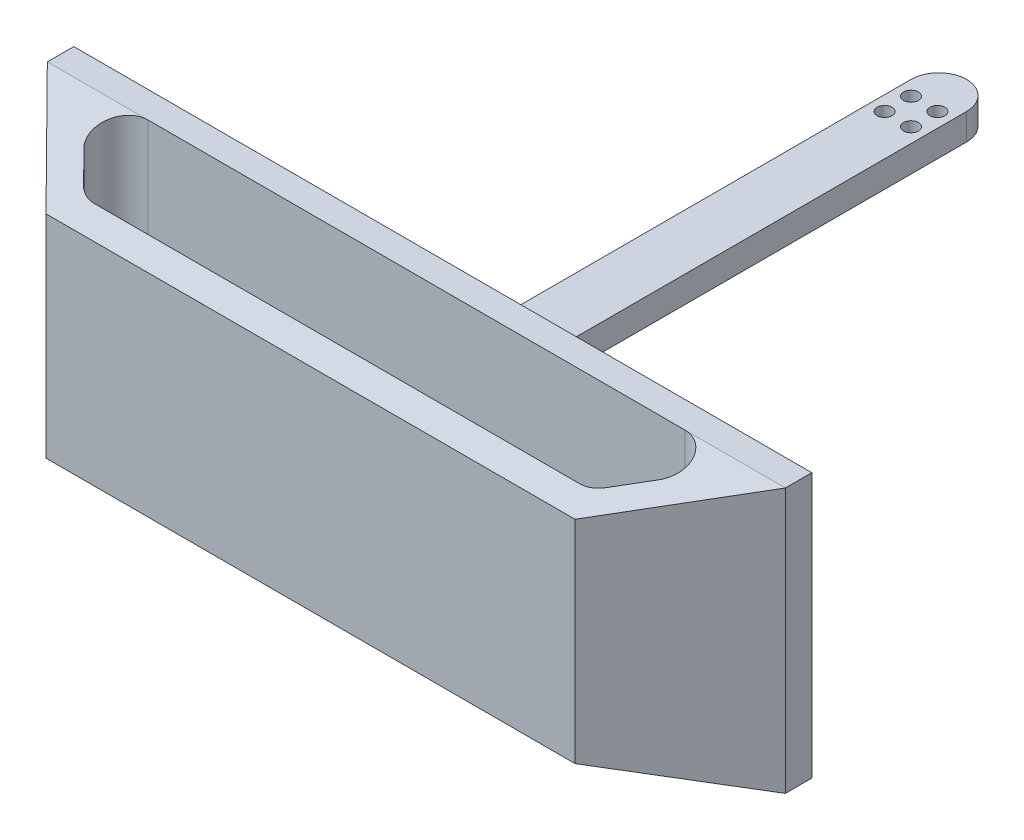
from build123d import *

# Parameters (mm, degrees)
SKETCH1_R               = 1.4
BOSS_EXTRUDE1_DEPTH     = 5
SKETCH3_W               = 139.5
SKETCH3_H               = 50
SKETCH3_R               = 1.4
BOSS_EXTRUDE3_DEPTH     = 5
CUT_EXTRUDE1_DEPTH      = 136.544503915
CUT_EXTRUDE1_DEPTH_BACK = 136.544503915
FILLET1_START           = -25
FILLET1_DEPTH           = 50
FILLET1_START_2         = -21.62169291
FILLET1_2_DEPTH         = 43.24338582
FILLET1_START_3         = -69.75
FILLET1_3_DEPTH         = 139.5


with BuildPart() as part:
    # Sketch1 → Boss-Extrude1 (new body)
    with BuildSketch(Plane(origin=(0, 0, 0), x_dir=(1, 0, 0), z_dir=(0, 1, 0))):
        with BuildLine():
            Line((-5.25, 5.25), (-5.25, -88.5))
            Line((-5.25, -88.5), (5.25, -88.5))
            Line((5.25, -88.5), (5.25, 5.25))
            ThreePointArc((5.25, 5.25), (0, 10.5), (-5.25, 5.25))
        make_face()
        with Locations(Location((-2.5, 2.5, 0), (0, 0, 270))):
            Circle(SKETCH1_R, mode=Mode.SUBTRACT)
        with Locations(Location((2.5, 2.5, 0), (0, 0, 90))):
            Circle(SKETCH1_R, mode=Mode.SUBTRACT)
        with Locations(Location((-2.5, -2.5, 0), (0, 0, 90))):
            Circle(SKETCH1_R, mode=Mode.SUBTRACT)
        with Locations(Location((2.5, -2.5, 0), (0, 0, 270))):
            Circle(SKETCH1_R, mode=Mode.SUBTRACT)
    extrude(amount=BOSS_EXTRUDE1_DEPTH)

    # Sketch3 → Boss-Extrude3 (add)
    with BuildSketch(Plane.XY.offset(88.5)):
        Rectangle(SKETCH3_W, SKETCH3_H)
        with Locations((-67, 0)):
            Circle(SKETCH3_R, mode=Mode.SUBTRACT)
        with Locations(Location((67, 0, 0), (0, 0, 180))):
            Circle(SKETCH3_R, mode=Mode.SUBTRACT)
    extrude(amount=BOSS_EXTRUDE3_DEPTH)

    # Sketch4 → Loft1 section 0
    with BuildSketch(Plane.XY.offset(93.5)):
        with BuildLine():
            Line((69.75, -25), (69.75, 25))
            Line((69.75, 25), (-69.75, 25))
            Line((-69.75, 25), (-69.75, -25))
            Line((-69.75, -25), (69.75, -25))
        make_face()
    # Sketch5 → Loft1 section 1
    with BuildSketch(Plane.XY.offset(113.5)):
        with BuildLine():
            Line((-50, -20), (50, -20))
            Line((50, -20), (50, 20))
            Line((50, 20), (-50, 20))
            Line((-50, 20), (-50, -20))
        make_face()
    loft()

    # Sketch6 → Cut-Extrude1 (cut, two sides: drawn at the far end of the back side and taken through both)
    with BuildSketch(Plane(origin=(0, 0, 0), x_dir=(1, 0, 0), z_dir=(0, 1, 0)).offset(-CUT_EXTRUDE1_DEPTH_BACK)):
        Polygon((-47.910487388, -108.5), (47.910487388, -108.5), (62.722987388, -93.5), (-62.722987388, -93.5), align=None)
    extrude(amount=CUT_EXTRUDE1_DEPTH + CUT_EXTRUDE1_DEPTH_BACK, mode=Mode.SUBTRACT)

    # Fillet1: read off the stored shape, not the designer's step
    # Fillet1 outline → Fillet1 (add)
    with BuildSketch(Plane(origin=(0, 0, 0), x_dir=(1, 0, 0), z_dir=(0, 1, 0)).offset(FILLET1_START)):
        with BuildLine():
            Line((-62.722987388, -93.5), (-54.316174382, -102.013228361))
            ThreePointArc((-54.316174382, -102.013228361), (-55.371832653, -96.572066106), (-50.758474776, -93.5))
            Line((-50.758474776, -93.5), (-62.722987388, -93.5))
        make_face()
        with BuildLine():
            ThreePointArc((50.758474776, -93.5), (55.371832653, -96.572066106), (54.316174382, -102.013228361))
            Line((54.316174382, -102.013228361), (62.722987388, -93.5))
            Line((62.722987388, -93.5), (50.758474776, -93.5))
        make_face()
    extrude(amount=FILLET1_DEPTH)

    # Fillet1 2 outline → Fillet1 2 (add)
    with BuildSketch(Plane(origin=(0, 0, 0), x_dir=(1, 0, 0), z_dir=(0, 1, 0)).offset(FILLET1_START_2)):
        with BuildLine():
            Line((-47.910487388, -108.5), (-45.820974776, -108.5))
            ThreePointArc((-45.820974776, -108.5), (-47.74890867, -108.113357877), (-49.378674382, -107.013228361))
            Line((-49.378674382, -107.013228361), (-47.910487388, -108.5))
        make_face()
        with BuildLine():
            ThreePointArc((49.378674382, -107.013228361), (47.74890867, -108.113357877), (45.820974776, -108.5))
            Line((45.820974776, -108.5), (47.910487388, -108.5))
            Line((47.910487388, -108.5), (49.378674382, -107.013228361))
        make_face()
    extrude(amount=FILLET1_2_DEPTH)

    # Fillet1 3 outline → Fillet1 3 (cut)
    with BuildSketch(Plane.YZ.offset(FILLET1_START_3)):
        Polygon((25, 93.5), (25, 110), (20.875, 110), align=None)
        Polygon((-20.875, 110), (-25, 110), (-25, 93.5), align=None)
    extrude(amount=FILLET1_3_DEPTH, mode=Mode.SUBTRACT)


solid = part.part
